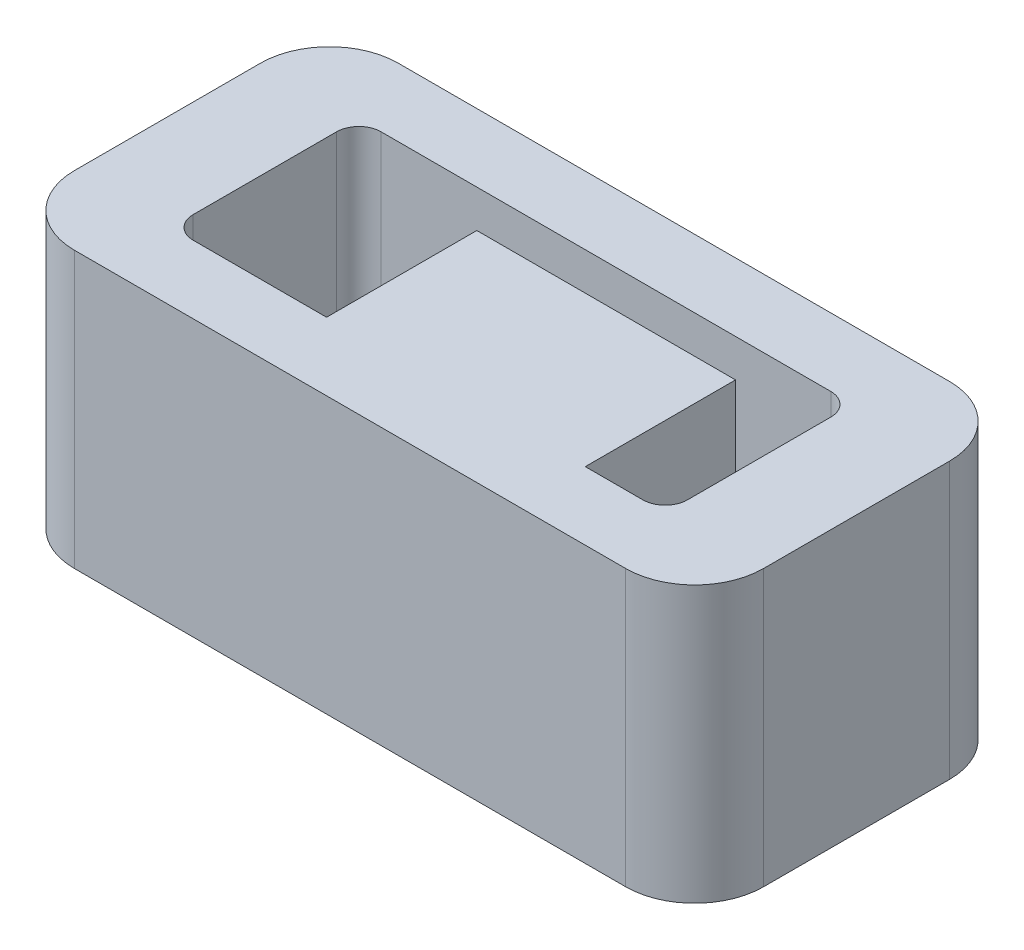
from build123d import *

# Parameters (mm, degrees)
SKETCH2_W                   = 100
SKETCH2_H                   = 47
BOSS_EXTRUDE1_DEPTH         = 40
FILLET1_R                   = 10
CUT_EXTRUDE1_REACH          = 70.207
M6_TAPPED_HOLE1_D           = 5
M6_TAPPED_HOLE1_DEPTH       = 17
M6_TAPPED_HOLE1_CSINK_D     = 6.05
M6_TAPPED_HOLE1_CSINK_ANGLE = 90
M6_TAPPED_HOLE1_TIP         = 1.502151548


with BuildPart() as part:
    # Sketch2 → Boss-Extrude1 (new body)
    with BuildSketch(Plane(origin=(0, 0, 0), x_dir=(1, 0, 0), z_dir=(0, 1, 0))):
        Rectangle(SKETCH2_W, SKETCH2_H)
    extrude(amount=-BOSS_EXTRUDE1_DEPTH)

    # Fillet1
    fillet1_edges = [part.edges().sort_by_distance(p)[0] for p in [
        (-50, -20, -23.5),
        (50, -20, -23.5),
        (50, -20, 23.5),
        (-50, -20, 23.5),
    ]]
    fillet(fillet1_edges, radius=FILLET1_R)

    # Sketch3 → Cut-Extrude1 (cut, up to next)
    with BuildSketch(Plane(origin=(0, 0, 0), x_dir=(1, 0, 0), z_dir=(0, 1, 0)), mode=Mode.PRIVATE) as cut_extrude1_sk1:
        with BuildLine():
            Line((35.855, -10.4), (35.855, 10.4))
            ThreePointArc((35.855, 10.4), (34.908954903, 12.683954903), (32.625, 13.63))
            Line((32.625, 13.63), (-32.625, 13.63))
            ThreePointArc((-32.625, 13.63), (-34.908954903, 12.683954903), (-35.855, 10.4))
            Line((-35.855, 10.4), (-35.855, -10.4))
            ThreePointArc((-35.855, -10.4), (-34.908954903, -12.683954903), (-32.625, -13.63))
            Line((-32.625, -13.63), (-13.275, -13.63))
            Line((-13.275, -13.63), (-13.275, 8.17))
            Line((-13.275, 8.17), (24.265, 8.17))
            Line((24.265, 8.17), (24.265, -13.63))
            Line((24.265, -13.63), (32.625, -13.63))
            ThreePointArc((32.625, -13.63), (34.908954903, -12.683954903), (35.855, -10.4))
        make_face()
    cut_extrude1_tool1 = extrude(cut_extrude1_sk1.sketch, amount=-CUT_EXTRUDE1_REACH, mode=Mode.PRIVATE) & part.part
    add(cut_extrude1_tool1.solids().sort_by_distance((-22.95, 0, 12.862834))[0], mode=Mode.SUBTRACT)

    # M6 Tapped Hole1
    with Locations(Plane(origin=(0, -40, 0), x_dir=(-1, 0, 0), z_dir=(0, -1, 0))):
        with Locations((-43, 16.5), (43, 16.5), (43, -16.5), (-43, -16.5)):
            CounterSinkHole(M6_TAPPED_HOLE1_D / 2, M6_TAPPED_HOLE1_CSINK_D / 2, depth=M6_TAPPED_HOLE1_DEPTH, counter_sink_angle=M6_TAPPED_HOLE1_CSINK_ANGLE)
            with Locations((0, 0, -(M6_TAPPED_HOLE1_DEPTH + M6_TAPPED_HOLE1_TIP / 2))):  # 118° drill point
                Cone(0, M6_TAPPED_HOLE1_D / 2, M6_TAPPED_HOLE1_TIP, mode=Mode.SUBTRACT)


solid = part.part
